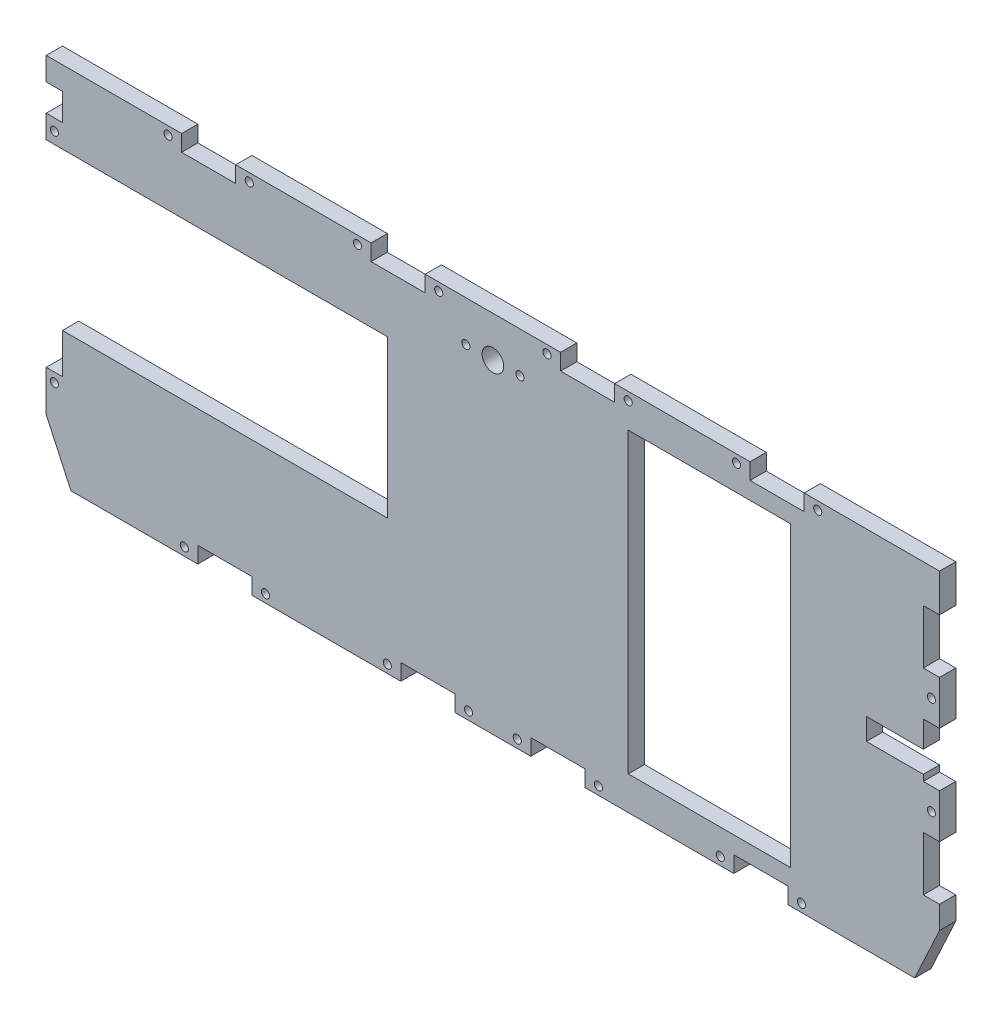
from build123d import *

# Parameters (mm, degrees)
BOSS_EXTRU_1_DEPTH      = 6
ESQUISSE3_W             = 6
ESQUISSE3_H             = 10
ESQUISSE3_W_2           = 20
ESQUISSE3_H_2           = 6
ESQUISSE3_W_3           = 60
ESQUISSE3_H_3           = 110
ESQUISSE3_H_4           = 20
ENL_V_MAT_EXTRU_2_DEPTH = 6
ESQUISSE4_R             = 1.5
ESQUISSE4_R_2           = 4
ENL_V_MAT_EXTRU_3_DEPTH = 6
ESQUISSE5_W             = 456.045253014
ESQUISSE5_H             = 136.228984631
ENL_V_MAT_EXTRU_4_DEPTH = 6
ESQUISSE6_W             = 21
ESQUISSE6_H             = 8
ENL_V_MAT_EXTRU_5_DEPTH = 10


with BuildPart() as part:
    # Esquisse1 → Boss.-Extru.1 (new body)
    with BuildSketch(Plane.XY):
        Polygon((-165, 96.73), (165, 96.73), (165, -18.27), (123, -109.022410436), (-123, -109.022410436), (-165, -18.27), align=None)
    extrude(amount=BOSS_EXTRU_1_DEPTH)

    # Esquisse3 → Enlèv. mat.-Extru.2 (cut)
    with BuildSketch(Plane(origin=(0, 0, 0), x_dir=(-1, 0, 0), z_dir=(0, 0, -1))):
        Polygon((165, -3.06), (159, -3.06), (159, 11.73), (39, 11.73), (39, 69.73), (165, 69.73), align=None)
        with Locations((162, 83.23258956)):
            Rectangle(ESQUISSE3_W, ESQUISSE3_H)
        with Locations((-24, -35.02)):
            Rectangle(ESQUISSE3_W_2, ESQUISSE3_H_2)
        with Locations((99, -35.02)):
            Rectangle(ESQUISSE3_W_2, ESQUISSE3_H_2)
        with Locations((-80, 29.355)):
            Rectangle(ESQUISSE3_W_3, ESQUISSE3_H_3)
        with Locations((-162, 72.73)):
            Rectangle(ESQUISSE3_W, ESQUISSE3_H_4)
        with Locations((24, -35.02)):
            Rectangle(ESQUISSE3_W_2, ESQUISSE3_H_2)
        with Locations((-162, 36.44)):
            Rectangle(ESQUISSE3_W, ESQUISSE3_H_4)
        with Locations((-162, 0.15)):
            Rectangle(ESQUISSE3_W, ESQUISSE3_H_4)
        with Locations((105, 93.73)):
            Rectangle(ESQUISSE3_W_2, ESQUISSE3_H_2)
        with Locations((-35, 93.73)):
            Rectangle(ESQUISSE3_W_2, ESQUISSE3_H_2)
        with Locations((35, 93.73)):
            Rectangle(ESQUISSE3_W_2, ESQUISSE3_H_2)
        with Locations((-105, 93.73)):
            Rectangle(ESQUISSE3_W_2, ESQUISSE3_H_2)
        with Locations((-99, -35.02)):
            Rectangle(ESQUISSE3_W_2, ESQUISSE3_H_2)
    extrude(amount=-ENL_V_MAT_EXTRU_2_DEPTH, mode=Mode.SUBTRACT)

    # Esquisse4 → Enlèv. mat.-Extru.3 (cut)
    with BuildSketch(Plane(origin=(0, 0, 0), x_dir=(-1, 0, 0), z_dir=(0, 0, -1))):
        with Locations((114, -35.02)):
            Circle(ESQUISSE4_R)
        with Locations((162, 73.98258956)):
            Circle(ESQUISSE4_R)
        with Locations((84, -35.02)):
            Circle(ESQUISSE4_R)
        with Locations((39, -35.02)):
            Circle(ESQUISSE4_R)
        with Locations((162, -6.46)):
            Circle(ESQUISSE4_R)
        with Locations((9, -35.02)):
            Circle(ESQUISSE4_R)
        with Locations((-9, -35.02)):
            Circle(ESQUISSE4_R)
        with Locations((-39, -35.02)):
            Circle(ESQUISSE4_R)
        with Locations((-84, -35.02)):
            Circle(ESQUISSE4_R)
        with Locations((120, 93.73)):
            Circle(ESQUISSE4_R)
        with Locations((-114, -35.02)):
            Circle(ESQUISSE4_R)
        with Locations((90, 93.73)):
            Circle(ESQUISSE4_R)
        with Locations((0, 81.73)):
            Circle(ESQUISSE4_R_2)
        with Locations((50, 93.73)):
            Circle(ESQUISSE4_R)
        with Locations((20, 93.73)):
            Circle(ESQUISSE4_R)
        with Locations((-162, 18.29)):
            Circle(ESQUISSE4_R)
        with Locations((-162, 54.585)):
            Circle(ESQUISSE4_R)
        with Locations((-20, 93.73)):
            Circle(ESQUISSE4_R)
        with Locations((-50, 93.73)):
            Circle(ESQUISSE4_R)
        with Locations((-90, 93.73)):
            Circle(ESQUISSE4_R)
        with Locations((-120, 93.73)):
            Circle(ESQUISSE4_R)
        with Locations((-10, 81.73)):
            Circle(ESQUISSE4_R)
        with Locations((10, 81.73)):
            Circle(ESQUISSE4_R)
    extrude(amount=-ENL_V_MAT_EXTRU_3_DEPTH, mode=Mode.SUBTRACT)

    # Esquisse5 → Enlèv. mat.-Extru.4 (cut)
    with BuildSketch(Plane(origin=(0, 0, 0), x_dir=(-1, 0, 0), z_dir=(0, 0, -1))):
        with Locations((-18.307092018, -106.134492316)):
            Rectangle(ESQUISSE5_W, ESQUISSE5_H)
    extrude(amount=-ENL_V_MAT_EXTRU_4_DEPTH, mode=Mode.SUBTRACT)

    # Esquisse6 → Enlèv. mat.-Extru.5 (cut)
    with BuildSketch(Plane(origin=(0, 0, 0), x_dir=(-1, 0, 0), z_dir=(0, 0, -1))):
        with Locations((-148.5, 32.73)):
            Rectangle(ESQUISSE6_W, ESQUISSE6_H)
    extrude(amount=-ENL_V_MAT_EXTRU_5_DEPTH, mode=Mode.SUBTRACT)


solid = part.part
